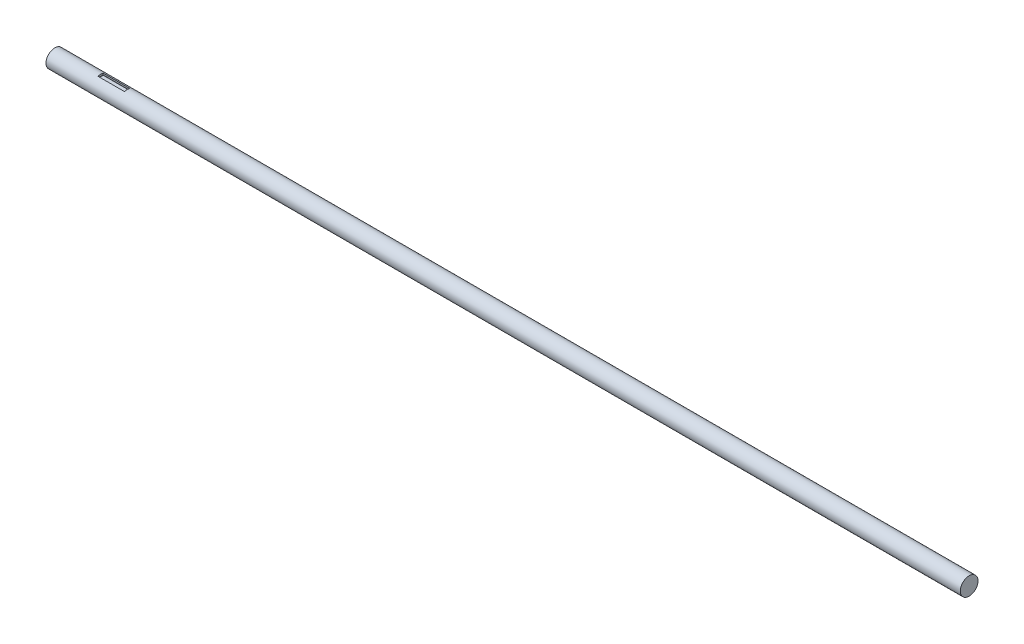
from build123d import *

# Parameters (mm, degrees)
SKETCH1_R           = 30
BOSS_EXTRUDE1_DEPTH = 3100
SKETCH4_W           = 90
SKETCH4_H           = 18
CUT_EXTRUDE1_DEPTH  = 7
FILLET1_R           = 0.6


with BuildPart() as part:
    # Sketch1 → Boss-Extrude1 (new body)
    with BuildSketch(Plane(origin=(0, 0, 0), x_dir=(0, 0, -1), z_dir=(1, 0, 0))):
        Circle(SKETCH1_R)
    extrude(amount=BOSS_EXTRUDE1_DEPTH)

    # Sketch4 → Cut-Extrude1 (cut)
    with BuildSketch(Plane(origin=(0, 30, 0), x_dir=(1, 0, 0), z_dir=(0, 1, 0))):
        with Locations((200, 0)):
            Rectangle(SKETCH4_W, SKETCH4_H)
    extrude(amount=-CUT_EXTRUDE1_DEPTH, mode=Mode.SUBTRACT)

    # Fillet1
    fillet1_edges = [part.edges().sort_by_distance(p)[0] for p in [
        (200, 23, 9),
        (245, 23, 0),
        (155, 23, 0),
        (200, 23, -9),
    ]]
    fillet(fillet1_edges, radius=FILLET1_R)


solid = part.part
